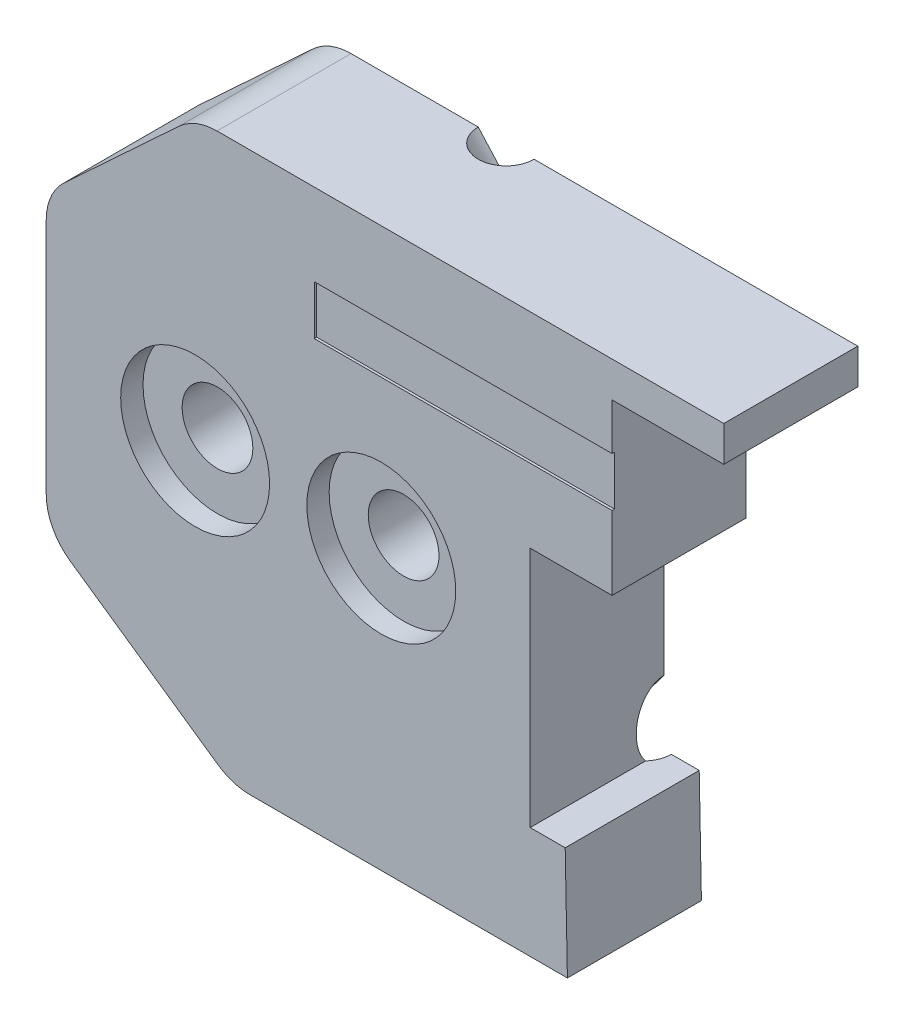
from build123d import *

# Parameters (mm, degrees)
BOSS_EXTRUDE1_DEPTH      = 2
BOSS_EXTRUDE2_DEPTH      = 6
SKETCH24_R               = 3.9
BOSS_EXTRUDE5_DEPTH      = 2.3
SKETCH30_W               = 2.408612022
SKETCH30_H               = 1.324178481
CUT_EXTRUDE12_DEPTH      = 8
CUT_EXTRUDE11_DEPTH      = 23.432788503
FILLET1_R                = 1.5
SKETCH34_R               = 0.75
CUT_EXTRUDE13_DEPTH      = 8
SKETCH35_R               = 0.75
CUT_EXTRUDE14_DEPTH      = 3
CUT_EXTRUDE14_DEPTH_BACK = 8
SKETCH36_R               = 0.95
CUT_EXTRUDE15_DEPTH      = 8
SKETCH37_R               = 2
CUT_EXTRUDE16_DEPTH      = 5
SKETCH38_W               = 3
SKETCH38_H               = 1.25
CUT_EXTRUDE17_DEPTH      = 3.6


with BuildPart() as part:
    # Sketch2 → Boss-Extrude1 (new body)
    with BuildSketch(Plane.XY):
        with BuildLine():
            Line((-2.5, 7.5), (-16.7, 7.5))
            Line((-16.7, 7.5), (-20.7, 3.793442666))
            Line((-20.7, 3.793442666), (-20.7, -4.031648778))
            Line((-20.7, -4.031648778), (-15.7, -7.5))
            Line((-15.7, -7.5), (-6.7, -7.5))
            Line((-6.7, -7.5), (-4.2, -5.6))
            ThreePointArc((-4.2, -5.6), (3.130495168, -6.260990337), (7, 0))
            ThreePointArc((7, 0), (4.949747468, 4.949747468), (0, 7))
            Line((0, 7), (0, 7.5))
            Line((0, 7.5), (-2.5, 7.5))
        make_face()
    extrude(amount=BOSS_EXTRUDE1_DEPTH)

    # Sketch4 → Boss-Extrude2 (add)
    with BuildSketch(Plane.XY.offset(2)):
        Polygon((-15.7, -7.5), (-6.7, -7.5), (-6.759079174, -4.5), (-7.7, -4.5), (-7.7, 2), (-5.5, 2), (-5.5, 5.3), (-2.5, 5.3), (-2.5, 7.5), (-16.7, 7.5), (-20.7, 3.793442666), (-20.7, -4.031648778), align=None)
    extrude(amount=BOSS_EXTRUDE2_DEPTH)

    # Sketch24 → Boss-Extrude5 (add)
    with BuildSketch(Plane.XY.offset(2)):
        Circle(SKETCH24_R)
    extrude(amount=BOSS_EXTRUDE5_DEPTH)

    # Sketch30 → Cut-Extrude12 (cut)
    with BuildSketch(Plane(origin=(-5.5, 0, 0), x_dir=(0, 0, -1), z_dir=(1, 0, 0))):
        with Locations((-3.261593395, 4.63791076)):
            Rectangle(SKETCH30_W, SKETCH30_H)
    extrude(amount=-CUT_EXTRUDE12_DEPTH, mode=Mode.SUBTRACT)

    # Sketch28 → Cut-Extrude11 (cut, through all)
    with BuildSketch(Plane.XY.offset(4.3)):
        with BuildLine():
            Line((-1, 1.732050808), (-1, -1.732050808))
            ThreePointArc((-1, -1.732050808), (2, 0), (-1, 1.732050808))
        make_face()
    extrude(amount=-CUT_EXTRUDE11_DEPTH, mode=Mode.SUBTRACT)

    # Fillet1
    fillet1_edges = [part.edges().sort_by_distance(p)[0] for p in [
        (-11.2, -7.5, 0),
        (-8.35, 7.5, 0),
        (-18.7, 5.646721333, 0),
        (-18.2, -5.765824389, 0),
        (-20.7, -0.119103056, 0),
        (-15.7, -7.5, 4),
        (-20.7, -4.031648778, 4),
        (-20.7, 3.793442666, 4),
        (-16.7, 7.5, 4),
    ]]
    fillet(fillet1_edges, radius=FILLET1_R)

    # Sketch34 → Cut-Extrude13 (cut, along a direction that is not the sketch's normal)
    with BuildSketch(Plane.XZ.offset(-2)):
        with Locations((-7, 8)):
            Circle(SKETCH34_R)
    extrude(amount=-CUT_EXTRUDE13_DEPTH, dir=(0.6685833876565112, -0.7436371788377336, 0), mode=Mode.SUBTRACT)

    # Sketch35 → Cut-Extrude14 (cut, two sides, along a direction that is not the sketch's normal)
    with BuildSketch(Plane(origin=(0, -4.5, 0), x_dir=(1, 0, 0), z_dir=(0, 1, 0))) as cut_extrude14_sk:
        with Locations((-8.259079174, -8)):
            Circle(SKETCH35_R)
    extrude(amount=CUT_EXTRUDE14_DEPTH, dir=(0.5999194182208608, 0.8000604299935998, 0), mode=Mode.SUBTRACT)
    extrude(cut_extrude14_sk.sketch, amount=-CUT_EXTRUDE14_DEPTH_BACK, dir=(0.5999194182208608, 0.8000604299935998, 0), mode=Mode.SUBTRACT)

    # Sketch36 → Cut-Extrude15 (cut)
    with BuildSketch(Plane.XY.offset(8)):
        with Locations((-11.7, 0)):
            Circle(SKETCH36_R)
        with Locations((-16.7, 0)):
            Circle(SKETCH36_R)
    extrude(amount=-CUT_EXTRUDE15_DEPTH, mode=Mode.SUBTRACT)

    # Sketch37 → Cut-Extrude16 (cut)
    with BuildSketch(Plane(origin=(0, 0, 0), x_dir=(-1, 0, 0), z_dir=(0, 0, -1))):
        with Locations((11.7, 0)):
            Circle(SKETCH37_R)
        with Locations((16.7, 0)):
            Circle(SKETCH37_R)
    extrude(amount=-CUT_EXTRUDE16_DEPTH, mode=Mode.SUBTRACT)

    # Sketch38 → Cut-Extrude17 (cut)
    with BuildSketch(Plane.XY.offset(8)):
        with Locations((-4, 5.925)):
            Rectangle(SKETCH38_W, SKETCH38_H)
    extrude(amount=-CUT_EXTRUDE17_DEPTH, mode=Mode.SUBTRACT)


with BuildPart() as body_2:
    # Split2: the piece on the far side of the plane
    add(part.part)
    split(bisect_by=Plane.XY.offset(4.4), keep=Keep.BOTTOM)


with BuildPart() as part_1:
    add(part.part)

    # Split2
    split(bisect_by=Plane.XY.offset(4.4), keep=Keep.TOP)


with BuildPart() as body_3:
    # Mirror2: read off the stored shape, not the designer's step
    # Mirror2: mirrored copy
    add(part_1.part.mirror(Plane.XY.offset(8)))


solid = body_3.part
